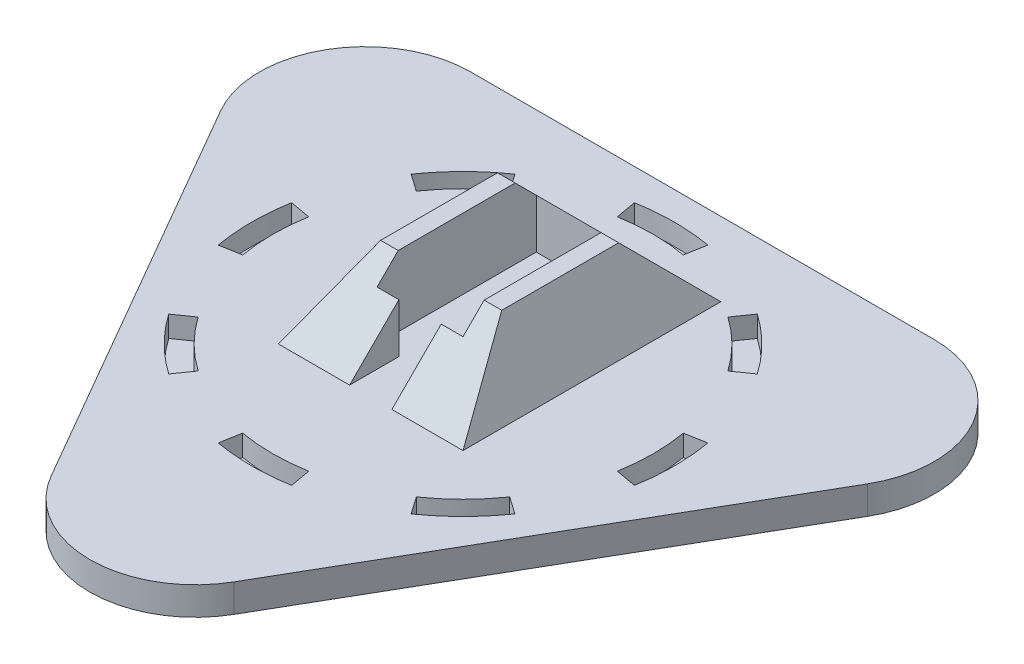
from build123d import *

# Parameters (mm, degrees)
BOSS_EXTRUDE1_DEPTH = 4
CUT_EXTRUDE1_DEPTH  = 3
SKETCH3_W           = 26.2
SKETCH3_H           = 36.6
SKETCH3_W_2         = 12.2
SKETCH3_H_2         = 22.6
BOSS_EXTRUDE8_DEPTH = 10
CHAMFER3_SIZE2      = 4.5
CHAMFER3_SIZE       = 10
CHAMFER4_SIZE2      = 10
CHAMFER4_SIZE       = 4.5
CHAMFER5_SIZE       = 10
CHAMFER6_SIZE       = 10
SKETCH4_W           = 6
SKETCH4_H           = 7
CUT_EXTRUDE2_DEPTH  = 69.48999168


# Some blends are built 0.0001 mm under size
with BuildPart() as part:
    # Sketch1 → Boss-Extrude1 (new body)
    with BuildSketch(Plane(origin=(0, 0, 0), x_dir=(1, 0, 0), z_dir=(0, 1, 0))):
        with BuildLine():
            Line((32.908965344, 34), (-32.908965344, 34))
            ThreePointArc((-32.908965344, 34), (-45.899346401, 26.5), (-45.899346401, 11.5))
            Line((-45.899346401, 11.5), (-12.990381057, -45.5))
            ThreePointArc((-12.990381057, -45.5), (0, -53), (12.990381057, -45.5))
            Line((12.990381057, -45.5), (45.899346401, 11.5))
            ThreePointArc((45.899346401, 11.5), (45.899346401, 26.5), (32.908965344, 34))
        make_face()
    extrude(amount=BOSS_EXTRUDE1_DEPTH)

    # Sketch2 → Cut-Extrude1 (cut)
    with BuildSketch(Plane(origin=(0, 4, 0), x_dir=(1, 0, 0), z_dir=(0, 1, 0))):
        with BuildLine():
            Line((4.688500797, 26.589809331), (5.20944533, 29.54423259))
            ThreePointArc((5.20944533, 29.54423259), (0, 30), (-5.20944533, 29.54423259))
            Line((-5.20944533, 29.54423259), (-4.688500797, 26.589809331))
            ThreePointArc((-4.688500797, 26.589809331), (0, 27), (4.688500797, 26.589809331))
        make_face()
        with BuildLine():
            Line((15.486563781, 22.117105196), (17.207293091, 24.574561329))
            ThreePointArc((17.207293091, 24.574561329), (21.213203436, 21.213203436), (24.574561329, 17.207293091))
            Line((24.574561329, 17.207293091), (22.117105196, 15.486563781))
            ThreePointArc((22.117105196, 15.486563781), (19.091883092, 19.091883092), (15.486563781, 22.117105196))
        make_face()
        with BuildLine():
            Line((26.589809331, 4.688500797), (29.54423259, 5.20944533))
            ThreePointArc((29.54423259, 5.20944533), (30, 0), (29.54423259, -5.20944533))
            Line((29.54423259, -5.20944533), (26.589809331, -4.688500797))
            ThreePointArc((26.589809331, -4.688500797), (27, 0), (26.589809331, 4.688500797))
        make_face()
        with BuildLine():
            Line((22.117105196, -15.486563781), (24.574561329, -17.207293091))
            ThreePointArc((24.574561329, -17.207293091), (21.213203436, -21.213203436), (17.207293091, -24.574561329))
            Line((17.207293091, -24.574561329), (15.486563781, -22.117105196))
            ThreePointArc((15.486563781, -22.117105196), (19.091883092, -19.091883092), (22.117105196, -15.486563781))
        make_face()
        with BuildLine():
            Line((4.688500797, -26.589809331), (5.20944533, -29.54423259))
            ThreePointArc((5.20944533, -29.54423259), (0, -30), (-5.20944533, -29.54423259))
            Line((-5.20944533, -29.54423259), (-4.688500797, -26.589809331))
            ThreePointArc((-4.688500797, -26.589809331), (0, -27), (4.688500797, -26.589809331))
        make_face()
        with BuildLine():
            Line((-15.486563781, -22.117105196), (-17.207293091, -24.574561329))
            ThreePointArc((-17.207293091, -24.574561329), (-21.213203436, -21.213203436), (-24.574561329, -17.207293091))
            Line((-24.574561329, -17.207293091), (-22.117105196, -15.486563781))
            ThreePointArc((-22.117105196, -15.486563781), (-19.091883092, -19.091883092), (-15.486563781, -22.117105196))
        make_face()
        with BuildLine():
            Line((-26.589809331, -4.688500797), (-29.54423259, -5.20944533))
            ThreePointArc((-29.54423259, -5.20944533), (-30, 0), (-29.54423259, 5.20944533))
            Line((-29.54423259, 5.20944533), (-26.589809331, 4.688500797))
            ThreePointArc((-26.589809331, 4.688500797), (-27, 0), (-26.589809331, -4.688500797))
        make_face()
        with BuildLine():
            Line((-22.117105196, 15.486563781), (-24.574561329, 17.207293091))
            ThreePointArc((-24.574561329, 17.207293091), (-21.213203436, 21.213203436), (-17.207293091, 24.574561329))
            Line((-17.207293091, 24.574561329), (-15.486563781, 22.117105196))
            ThreePointArc((-15.486563781, 22.117105196), (-19.091883092, 19.091883092), (-22.117105196, 15.486563781))
        make_face()
    extrude(amount=-CUT_EXTRUDE1_DEPTH, mode=Mode.SUBTRACT)

    # Sketch3 → Boss-Extrude8 (add)
    with BuildSketch(Plane(origin=(0, 4, 0), x_dir=(1, 0, 0), z_dir=(0, 1, 0))):
        with Locations((0, 5.2)):
            Rectangle(SKETCH3_W, SKETCH3_H)
        with Locations((0, 5.2)):
            Rectangle(SKETCH3_W_2, SKETCH3_H_2, mode=Mode.SUBTRACT)
    extrude(amount=BOSS_EXTRUDE8_DEPTH)

    # Chamfer3
    chamfer3_edges = [part.edges().sort_by_distance(p)[0] for p in [
        (-13.1, 14, -5.2),
    ]]
    chamfer3_side = [part.faces().sort_by_distance(p)[0] for p in [
        (-13.1, 13.91, -5.2),
    ]]
    chamfer(chamfer3_edges, length=CHAMFER3_SIZE - 0.0001, length2=CHAMFER3_SIZE2 - 0.0001, reference=chamfer3_side[0])  # a hair under: the kernel refuses the full size

    # Chamfer4
    chamfer4_edges = [part.edges().sort_by_distance(p)[0] for p in [
        (13.1, 14, -5.2),
    ]]
    chamfer4_side = [part.faces().sort_by_distance(p)[0] for p in [
        (13.01, 14, -5.2),
    ]]
    chamfer(chamfer4_edges, length=CHAMFER4_SIZE - 0.0001, length2=CHAMFER4_SIZE2 - 0.0001, reference=chamfer4_side[0])  # a hair under: the kernel refuses the full size

    # Chamfer5
    # the kernel refuses this chamfer: 10 mm, written as the material it takes off along each edge
    with BuildSketch(Plane(origin=(-34.31692988, 14, -23.5), x_dir=(0, 0.027495876610586317, 0.9996219169112968), z_dir=(1, 0, 0))) as chamfer5_piece_1_section:
        Polygon((CHAMFER5_SIZE * 0.999621916911, CHAMFER5_SIZE * 0.0274958766106), (-CHAMFER5_SIZE * 0.0274958766106, CHAMFER5_SIZE * 0.999621916911), (0, 0), align=None)
    chamfer5_piece_1 = extrude(amount=68.633859759, mode=Mode.PRIVATE)
    chamfer5_piece_1 = split(chamfer5_piece_1, bisect_by=Plane(origin=(0, 4, -20.195958457), z_dir=(0, 1, 0)), keep=Keep.TOP, mode=Mode.PRIVATE)
    add(chamfer5_piece_1, mode=Mode.SUBTRACT)

    # Chamfer6
    # the kernel refuses this chamfer: 10 mm, written as the material it takes off along each edge
    with BuildSketch(Plane(origin=(34.31692988, 14, 13.1), x_dir=(0, -0.9996219169112968, 0.027495876610586317), z_dir=(-1, 0, 0))) as chamfer6_piece_1_section:
        Polygon((CHAMFER6_SIZE * 0.999621916911, -CHAMFER6_SIZE * 0.0274958766106), (-CHAMFER6_SIZE * 0.0274958766106, -CHAMFER6_SIZE * 0.999621916911), (0, 0), align=None)
    chamfer6_piece_1 = extrude(amount=68.633859759, mode=Mode.PRIVATE)
    chamfer6_piece_1 = split(chamfer6_piece_1, bisect_by=Plane(origin=(0, 4, 9.795958457), z_dir=(0, 1, 0)), keep=Keep.TOP, mode=Mode.PRIVATE)
    add(chamfer6_piece_1, mode=Mode.SUBTRACT)

    # Sketch4 → Cut-Extrude2 (cut, through all)
    with BuildSketch(Plane(origin=(0, 0, 6.1), x_dir=(-1, 0, 0), z_dir=(0, 0, -1))):
        with Locations((0, 7.5)):
            Rectangle(SKETCH4_W, SKETCH4_H)
    extrude(amount=-CUT_EXTRUDE2_DEPTH, mode=Mode.SUBTRACT)


solid = part.part
